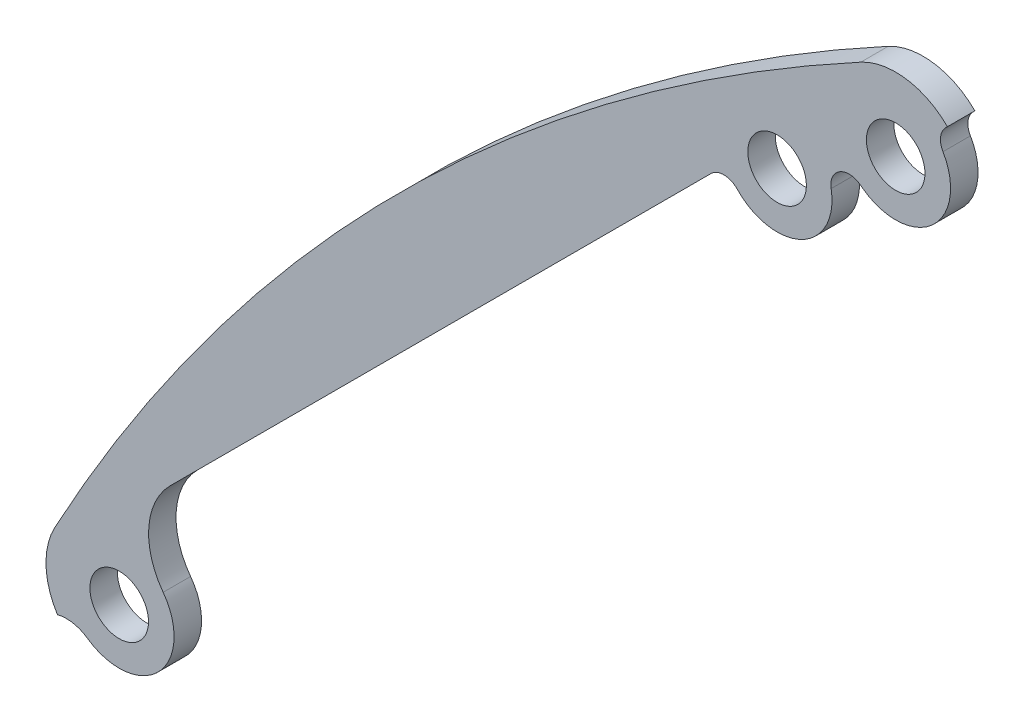
from build123d import *

# Parameters (mm, degrees)
FILLET1_OUTLINE_R    = 1.6
FILLET1_OUTLINE_R_2  = 1.4
FILLET1_DEPTH        = 1.5
FILLET2_R            = 1
FILLET3_R            = 4
FILLET6_R            = 1
FILLET7_R            = 1
FILLET8_R            = 2
BOSS_EXTRUDE1_DEPTH  = 1.5
FILLET9_R            = 4
BOSS_EXTRUDE2_START  = -1.5
SKETCH2_R            = 1.6
BOSS_EXTRUDE2_DEPTH  = 1.5
BOSS_EXTRUDE3_START  = -1.5
SKETCH3_R            = 1.6
BOSS_EXTRUDE3_DEPTH  = 1.5
CUT_EXTRUDE1_START   = -1.5
SKETCH4_R            = 1.6
CUT_EXTRUDE1_DEPTH   = 1.5
CUT_EXTRUDE3_DEPTH   = 10
FILLET10_R           = 2
SKETCH6_R            = 61
CUT_EXTRUDE4_DEPTH   = 10
CUT_EXTRUDE5_DEPTH   = 10
FILLET12_R           = 1
SKETCH8_R            = 1.6
BOSS_EXTRUDE5_DEPTH  = 5
CUT_EXTRUDE6_START   = -5
CUT_EXTRUDE6_DEPTH   = 5
SKETCH10_R           = 133.204065673
CUT_EXTRUDE7_DEPTH   = 1.5
FILLET13_R           = 1
FILLET14_R           = 2
CUT_EXTRUDE10_START  = -10
CUT_EXTRUDE10_DEPTH  = 10
BOSS_EXTRUDE10_DEPTH = 5
FILLET15_START       = 1
FILLET15_DEPTH       = 6
CUT_EXTRUDE13_START  = -10
CUT_EXTRUDE13_DEPTH  = 10
FILLET16_R           = 4
SKETCH14_R           = 1.6
CUT_EXTRUDE16_DEPTH  = 10
SKETCH15_R           = 3
SKETCH15_R_2         = 1.6
BOSS_EXTRUDE11_DEPTH = 5
FILLET17_R           = 1
SKETCH16_R           = 171.814222802
CUT_EXTRUDE17_DEPTH  = 3.5


with BuildPart() as part:
    # Fillet1: read off the stored shape, not the designer's step
    # Fillet1 outline → Fillet1 (new body)
    with BuildSketch(Plane.XY):
        with BuildLine():
            Line((-52.766471043, 89.536023665), (-42.779960262, 79.549512884))
            Line((-42.779960262, 79.549512884), (-79.549512883, 42.779960262))
            Line((-79.549512883, 42.779960262), (-89.536023665, 52.766471043))
            ThreePointArc((-89.536023665, 52.766471043), (-92.941929118, 53.896139266), (-95.883096534, 51.840445591))
            ThreePointArc((-95.883096534, 51.840445591), (-109, 0), (-95.883096534, -51.840445591))
            ThreePointArc((-95.883096534, -51.840445591), (-92.941929118, -53.896139266), (-89.536023665, -52.766471043))
            Line((-89.536023665, -52.766471043), (-79.549512883, -42.779960262))
            Line((-79.549512883, -42.779960262), (-42.779960262, -79.549512883))
            Line((-42.779960262, -79.549512883), (-52.766471043, -89.536023665))
            ThreePointArc((-52.766471043, -89.536023665), (-53.896139266, -92.941929118), (-51.840445591, -95.883096534))
            ThreePointArc((-51.840445591, -95.883096534), (-50.184016899, -96.760345431), (-48.512748328, -97.608981399))
            ThreePointArc((-48.512748328, -97.608981399), (-47.646815155, -97.921093641), (-46.732463985, -98.02700043))
            Line((-46.732463985, -98.02700043), (46.732463985, -98.02700043))
            ThreePointArc((46.732463985, -98.02700043), (47.646815155, -97.921093641), (48.512748328, -97.608981399))
            ThreePointArc((48.512748328, -97.608981399), (50.184016899, -96.760345431), (51.840445591, -95.883096534))
            ThreePointArc((51.840445591, -95.883096534), (53.896139266, -92.941929118), (52.766471043, -89.536023665))
            Line((52.766471043, -89.536023665), (42.779960262, -79.549512884))
            Line((42.779960262, -79.549512884), (79.549512884, -42.779960262))
            Line((79.549512884, -42.779960262), (89.536023665, -52.766471043))
            ThreePointArc((89.536023665, -52.766471043), (92.941929118, -53.896139266), (95.883096534, -51.840445591))
            ThreePointArc((95.883096534, -51.840445591), (109, 0), (95.883096534, 51.840445591))
            ThreePointArc((95.883096534, 51.840445591), (92.941929118, 53.896139266), (89.536023665, 52.766471043))
            Line((89.536023665, 52.766471043), (79.549512883, 42.779960262))
            Line((79.549512883, 42.779960262), (42.779960262, 79.549512884))
            Line((42.779960262, 79.549512884), (52.766471043, 89.536023665))
            ThreePointArc((52.766471043, 89.536023665), (53.896139266, 92.941929118), (51.840445591, 95.883096534))
            ThreePointArc((51.840445591, 95.883096534), (51.446125895, 96.095245098), (51.050938033, 96.305772029))
            Line((51.050938033, 96.305772029), (31.745166004, 77))
            Line((31.745166004, 77), (-31.745166004, 77))
            Line((-31.745166004, 77), (-51.050938033, 96.305772029))
            ThreePointArc((-51.050938033, 96.305772029), (-51.446125895, 96.095245098), (-51.840445591, 95.883096534))
            ThreePointArc((-51.840445591, 95.883096534), (-53.896139266, 92.941929118), (-52.766471043, 89.536023665))
        make_face()
        with Locations((-92.27579683, -50.101669827)):
            Circle(FILLET1_OUTLINE_R, mode=Mode.SUBTRACT)
        with Locations((-50.101669828, -92.275796829)):
            Circle(FILLET1_OUTLINE_R, mode=Mode.SUBTRACT)
        with BuildLine():
            Line((-27.999999998, -90.02700043), (-41.861882029, -90.02700043))
            Line((-41.861882029, -90.02700043), (-37.123106012, -85.206367133))
            ThreePointArc((-37.123106012, -85.206367133), (-34.779960262, -79.549512884), (-37.123106012, -73.892658634))
            Line((-37.123106012, -73.892658634), (-44.194173825, -66.821590821))
            Line((-44.194173825, -66.821590821), (-35.419577284, -58.046994281))
            ThreePointArc((-35.419577284, -58.046994281), (-31.770328056, -60.12192824), (-27.999999998, -61.96773354))
            Line((-27.999999998, -61.96773354), (-27.999999998, -90.02700043))
        make_face(mode=Mode.SUBTRACT)
        with Locations((-23.999999998, -90)):
            Circle(FILLET1_OUTLINE_R, mode=Mode.SUBTRACT)
        with Locations((-46.492270863, -64.877047174)):
            Circle(FILLET1_OUTLINE_R_2, mode=Mode.SUBTRACT)
        with BuildLine():
            Line((-40.489419991, -54.631555614), (-48.436814511, -62.578950135))
            Line((-48.436814511, -62.578950135), (-62.479030953, -48.536733693))
            Line((-62.479030953, -48.536733693), (-54.492060142, -40.676963769))
            ThreePointArc((-54.492060142, -40.676963769), (-48.000552605, -48.165827612), (-40.489419991, -54.631555614))
        make_face(mode=Mode.SUBTRACT)
        with Locations((-40.835416614, -59.220192924)):
            Circle(FILLET1_OUTLINE_R_2, mode=Mode.SUBTRACT)
        with Locations((-64.877047174, -46.492270863)):
            Circle(FILLET1_OUTLINE_R_2, mode=Mode.SUBTRACT)
        with Locations((-59.220192925, -40.835416614)):
            Circle(FILLET1_OUTLINE_R_2, mode=Mode.SUBTRACT)
        with BuildLine():
            ThreePointArc((-73.892658634, -37.123106012), (-79.549512884, -34.779960262), (-85.206367133, -37.123106012))
            ThreePointArc((-85.206367133, -37.123106012), (-88.293174595, -40.113953283), (-91.303559052, -43.1817103))
            ThreePointArc((-91.303559052, -43.1817103), (-94.614957198, -35.341333794), (-97.254498611, -27.25))
            Line((-97.254498611, -27.25), (-62.301183777, -27.25))
            ThreePointArc((-62.301183777, -27.25), (-60.218013119, -31.58782829), (-57.833278956, -35.767469092))
            Line((-57.833278956, -35.767469092), (-66.690457063, -44.325307583))
            Line((-66.690457063, -44.325307583), (-73.892658634, -37.123106012))
        make_face(mode=Mode.SUBTRACT)
        with Locations((-98, -23.25)):
            Circle(FILLET1_OUTLINE_R, mode=Mode.SUBTRACT)
        with Locations((-68.5, -23.25)):
            Circle(FILLET1_OUTLINE_R, mode=Mode.SUBTRACT)
        with Locations((23.999999998, -90)):
            Circle(FILLET1_OUTLINE_R, mode=Mode.SUBTRACT)
        with Locations((50.101669827, -92.275796829)):
            Circle(FILLET1_OUTLINE_R, mode=Mode.SUBTRACT)
        with BuildLine():
            ThreePointArc((28, -61.967733539), (31.770328056, -60.121928239), (35.419577283, -58.046994281))
            Line((35.419577283, -58.046994281), (44.194173824, -66.821590822))
            Line((44.194173824, -66.821590822), (37.123106012, -73.892658634))
            ThreePointArc((37.123106012, -73.892658634), (34.779960262, -79.549512884), (37.123106012, -85.206367133))
            ThreePointArc((37.123106012, -85.206367133), (39.468585064, -87.64018675), (41.861882029, -90.02700043))
            Line((41.861882029, -90.02700043), (28, -90.02700043))
            Line((28, -90.02700043), (28, -61.967733539))
        make_face(mode=Mode.SUBTRACT)
        with Locations((46.492270863, -64.877047174)):
            Circle(FILLET1_OUTLINE_R_2, mode=Mode.SUBTRACT)
        with Locations((40.835416614, -59.220192924)):
            Circle(FILLET1_OUTLINE_R_2, mode=Mode.SUBTRACT)
        with BuildLine():
            Line((62.479030953, -48.536733693), (48.436814511, -62.578950135))
            Line((48.436814511, -62.578950135), (40.489419991, -54.631555614))
            ThreePointArc((40.489419991, -54.631555614), (48.000552605, -48.165827612), (54.492060142, -40.676963769))
            Line((54.492060142, -40.676963769), (62.479030953, -48.536733693))
        make_face(mode=Mode.SUBTRACT)
        with Locations((92.27579683, -50.101669827)):
            Circle(FILLET1_OUTLINE_R, mode=Mode.SUBTRACT)
        with BuildLine():
            ThreePointArc((-20, -56.568542495), (0, 60), (20, -56.568542495))
            Line((20, -56.568542495), (20, -94.013500215))
            Line((20, -94.013500215), (-4e-09, -94.02700043))
            Line((-4e-09, -94.02700043), (-20, -94.013500215))
            Line((-20, -94.013500215), (-20, -56.568542495))
        make_face(mode=Mode.SUBTRACT)
        with Locations((64.877047174, -46.492270863)):
            Circle(FILLET1_OUTLINE_R_2, mode=Mode.SUBTRACT)
        with Locations((59.220192924, -40.835416614)):
            Circle(FILLET1_OUTLINE_R_2, mode=Mode.SUBTRACT)
        with BuildLine():
            Line((62.301183777, -27.25), (97.254498611, -27.25))
            ThreePointArc((97.254498611, -27.25), (94.614957198, -35.341333794), (91.303559052, -43.1817103))
            ThreePointArc((91.303559052, -43.1817103), (88.293174595, -40.113953283), (85.206367133, -37.123106012))
            ThreePointArc((85.206367133, -37.123106012), (79.549512884, -34.779960262), (73.892658634, -37.123106012))
            Line((73.892658634, -37.123106012), (66.690457063, -44.325307584))
            Line((66.690457063, -44.325307584), (57.833278956, -35.767469092))
            ThreePointArc((57.833278956, -35.767469092), (60.218013119, -31.58782829), (62.301183777, -27.25))
        make_face(mode=Mode.SUBTRACT)
        with Locations((68.5, -23.25)):
            Circle(FILLET1_OUTLINE_R, mode=Mode.SUBTRACT)
        with Locations((98, -23.25)):
            Circle(FILLET1_OUTLINE_R, mode=Mode.SUBTRACT)
        with BuildLine():
            ThreePointArc((-99.148562773, -19.25), (-101, 0), (-99.148562773, 19.25))
            Line((-99.148562773, 19.25), (-65.218383145, 19.25))
            ThreePointArc((-65.218383145, 19.25), (-68, 0), (-65.218383145, -19.25))
            Line((-65.218383145, -19.25), (-99.148562773, -19.25))
        make_face(mode=Mode.SUBTRACT)
        with Locations((-98, 23.25)):
            Circle(FILLET1_OUTLINE_R, mode=Mode.SUBTRACT)
        with Locations((-64, 0)):
            Circle(FILLET1_OUTLINE_R, mode=Mode.SUBTRACT)
        with Locations((-68.5, 23.25)):
            Circle(FILLET1_OUTLINE_R, mode=Mode.SUBTRACT)
        with BuildLine():
            Line((-62.301183777, 27.25), (-97.254498611, 27.25))
            ThreePointArc((-97.254498611, 27.25), (-94.614957198, 35.341333794), (-91.303559052, 43.1817103))
            ThreePointArc((-91.303559052, 43.1817103), (-88.293174595, 40.113953283), (-85.206367133, 37.123106012))
            ThreePointArc((-85.206367133, 37.123106012), (-79.549512884, 34.779960262), (-73.892658634, 37.123106012))
            Line((-73.892658634, 37.123106012), (-66.690457063, 44.325307584))
            Line((-66.690457063, 44.325307584), (-57.833278956, 35.767469092))
            ThreePointArc((-57.833278956, 35.767469092), (-60.218013119, 31.58782829), (-62.301183777, 27.25))
        make_face(mode=Mode.SUBTRACT)
        with Locations((-59.220192925, 40.835416614)):
            Circle(FILLET1_OUTLINE_R_2, mode=Mode.SUBTRACT)
        with Locations((-64.877047174, 46.492270863)):
            Circle(FILLET1_OUTLINE_R_2, mode=Mode.SUBTRACT)
        with Locations((-92.27579683, 50.101669827)):
            Circle(FILLET1_OUTLINE_R, mode=Mode.SUBTRACT)
        with BuildLine():
            ThreePointArc((-40.489419991, 54.631555614), (-48.000552605, 48.165827612), (-54.492060142, 40.676963769))
            Line((-54.492060142, 40.676963769), (-62.479030953, 48.536733693))
            Line((-62.479030953, 48.536733693), (-48.436814511, 62.578950135))
            Line((-48.436814511, 62.578950135), (-40.489419991, 54.631555614))
        make_face(mode=Mode.SUBTRACT)
        with Locations((-40.835416614, 59.220192924)):
            Circle(FILLET1_OUTLINE_R_2, mode=Mode.SUBTRACT)
        with Locations((-46.492270863, 64.877047174)):
            Circle(FILLET1_OUTLINE_R_2, mode=Mode.SUBTRACT)
        with BuildLine():
            Line((-44.194173824, 66.821590822), (-40.015764646, 71))
            Line((-40.015764646, 71), (-31.745166004, 71))
            Line((-31.745166004, 71), (-18.99999793, 70.951058904))
            Line((-18.99999793, 70.951058904), (-18.999992628, 68.264642036))
            Line((-18.999992628, 68.264642036), (-19.01142159, 65.288328583))
            ThreePointArc((-19.01142159, 65.288328583), (-27.455284376, 62.210990667), (-35.419577283, 58.046994281))
            Line((-35.419577283, 58.046994281), (-44.194173824, 66.821590822))
        make_face(mode=Mode.SUBTRACT)
        with Locations((-15, 66.122776602)):
            Circle(FILLET1_OUTLINE_R, mode=Mode.SUBTRACT)
        with Locations((-36.042175759, 77.089910724)):
            Circle(FILLET1_OUTLINE_R, mode=Mode.SUBTRACT)
        with Locations((-51.089613767, 91.732498958)):
            Circle(FILLET1_OUTLINE_R, mode=Mode.SUBTRACT)
        with Locations((64, 0)):
            Circle(FILLET1_OUTLINE_R, mode=Mode.SUBTRACT)
        with Locations((68.5, 23.25)):
            Circle(FILLET1_OUTLINE_R, mode=Mode.SUBTRACT)
        with BuildLine():
            ThreePointArc((99.148562773, 19.25), (101, 0), (99.148562773, -19.25))
            Line((99.148562773, -19.25), (65.218383145, -19.25))
            ThreePointArc((65.218383145, -19.25), (68, 0), (65.218383145, 19.25))
            Line((65.218383145, 19.25), (99.148562773, 19.25))
        make_face(mode=Mode.SUBTRACT)
        with Locations((98, 23.25)):
            Circle(FILLET1_OUTLINE_R, mode=Mode.SUBTRACT)
        with Locations((59.220192924, 40.835416614)):
            Circle(FILLET1_OUTLINE_R_2, mode=Mode.SUBTRACT)
        with Locations((64.877047174, 46.492270863)):
            Circle(FILLET1_OUTLINE_R_2, mode=Mode.SUBTRACT)
        with BuildLine():
            ThreePointArc((73.892658634, 37.123106012), (79.549512884, 34.779960262), (85.206367133, 37.123106012))
            ThreePointArc((85.206367133, 37.123106012), (88.293174595, 40.113953283), (91.303559052, 43.1817103))
            ThreePointArc((91.303559052, 43.1817103), (94.614957198, 35.341333794), (97.254498611, 27.25))
            Line((97.254498611, 27.25), (62.301183777, 27.25))
            ThreePointArc((62.301183777, 27.25), (60.218013119, 31.58782829), (57.833278956, 35.767469092))
            Line((57.833278956, 35.767469092), (66.690457063, 44.325307583))
            Line((66.690457063, 44.325307583), (73.892658634, 37.123106012))
        make_face(mode=Mode.SUBTRACT)
        with Locations((0, 64)):
            Circle(FILLET1_OUTLINE_R, mode=Mode.SUBTRACT)
        with BuildLine():
            Line((-11, 67.104396279), (-11, 70.930497512))
            Line((-11, 70.930497512), (0, 71))
            Line((0, 71), (11, 71))
            Line((11, 71), (11, 67.104396279))
            ThreePointArc((11, 67.104396279), (0, 68), (-11, 67.104396279))
        make_face(mode=Mode.SUBTRACT)
        with Locations((15, 66.122776602)):
            Circle(FILLET1_OUTLINE_R, mode=Mode.SUBTRACT)
        with Locations((40.835416614, 59.220192924)):
            Circle(FILLET1_OUTLINE_R_2, mode=Mode.SUBTRACT)
        with BuildLine():
            ThreePointArc((54.492060142, 40.676963769), (48.000552606, 48.165827612), (40.489419991, 54.631555614))
            Line((40.489419991, 54.631555614), (48.436814511, 62.578950135))
            Line((48.436814511, 62.578950135), (62.479030953, 48.536733693))
            Line((62.479030953, 48.536733693), (54.492060142, 40.676963769))
        make_face(mode=Mode.SUBTRACT)
        with BuildLine():
            Line((19.012475672, 65.288021634), (18.990729901, 70.951023316))
            Line((18.990729901, 70.951023316), (31.745166003, 71))
            Line((31.745166003, 71), (40.015764645, 71))
            Line((40.015764645, 71), (44.194173823, 66.821590822))
            Line((44.194173823, 66.821590822), (35.419577282, 58.046994281))
            ThreePointArc((35.419577282, 58.046994281), (27.455786576, 62.210769032), (19.012475672, 65.288021634))
        make_face(mode=Mode.SUBTRACT)
        with Locations((46.492270863, 64.877047174)):
            Circle(FILLET1_OUTLINE_R_2, mode=Mode.SUBTRACT)
        with Locations((36.042175759, 77.089910724)):
            Circle(FILLET1_OUTLINE_R, mode=Mode.SUBTRACT)
        with Locations((51.089613767, 91.732498958)):
            Circle(FILLET1_OUTLINE_R, mode=Mode.SUBTRACT)
        with Locations((92.27579683, 50.101669827)):
            Circle(FILLET1_OUTLINE_R, mode=Mode.SUBTRACT)
    extrude(amount=FILLET1_DEPTH)

    # Fillet2
    fillet2_edges = [part.edges().sort_by_distance(p)[0] for p in [
        (-51.050938033, 96.305772029, 0.75),
        (51.050938033, 96.305772029, 0.75),
    ]]
    fillet(fillet2_edges, radius=FILLET2_R)

    # Fillet3
    fillet3_edges = [part.edges().sort_by_distance(p)[0] for p in [
        (-31.745166004, 77, 0.75),
        (31.745166004, 77, 0.75),
    ]]
    fillet(fillet3_edges, radius=FILLET3_R)

    # Fillet6
    fillet6_edges = [part.edges().sort_by_distance(p)[0] for p in [
        (-48.436814511, 62.578950135, 0.75),
        (-40.489419991, 54.631555614, 0.75),
        (-62.479030953, 48.536733693, 0.75),
        (-54.492060142, 40.676963769, 0.75),
        (-44.194173824, 66.821590822, 0.75),
        (-40.015764646, 71, 0.75),
        (-35.419577283, 58.046994281, 0.75),
        (-19.01142159, 65.288328583, 0.75),
        (-18.99999793, 70.951058904, 0.75),
        (-31.745166004, 71, 0.75),
        (-57.833278956, 35.767469092, 0.75),
        (-66.690457063, 44.325307584, 0.75),
        (19.012475672, 65.288021634, 0.75),
        (18.990729901, 70.951023316, 0.75),
        (35.419577282, 58.046994281, 0.75),
        (44.194173823, 66.821590822, 0.75),
        (40.015764645, 71, 0.75),
        (31.745166003, 71, 0.75),
        (54.492060142, 40.676963769, 0.75),
        (40.489419991, 54.631555614, 0.75),
        (62.479030953, 48.536733693, 0.75),
        (48.436814511, 62.578950135, 0.75),
        (-11, 67.104396279, 0.75),
        (-11, 70.930497512, 0.75),
        (11, 67.104396279, 0.75),
        (11, 71, 0.75),
    ]]
    fillet(fillet6_edges, radius=FILLET6_R)

    # Fillet7
    fillet7_edges = [part.edges().sort_by_distance(p)[0] for p in [
        (40.489419991, -54.631555614, 0.75),
        (54.492060142, -40.676963769, 0.75),
        (48.436814511, -62.578950135, 0.75),
        (62.479030953, -48.536733693, 0.75),
        (-54.492060142, -40.676963769, 0.75),
        (-40.489419991, -54.631555614, 0.75),
        (-62.479030953, -48.536733693, 0.75),
        (-48.436814511, -62.578950135, 0.75),
        (66.690457063, 44.325307583, 0.75),
        (57.833278956, 35.767469092, 0.75),
        (62.301183777, 27.25, 0.75),
        (97.254498611, 27.25, 0.75),
        (91.303559052, 43.1817103, 0.75),
        (-99.148562773, 19.25, 0.75),
        (-99.148562773, -19.25, 0.75),
        (-65.218383145, -19.25, 0.75),
        (-65.218383145, 19.25, 0.75),
        (-66.690457063, -44.325307583, 0.75),
        (-57.833278956, -35.767469092, 0.75),
        (-62.301183777, -27.25, 0.75),
        (-97.254498611, -27.25, 0.75),
        (-91.303559052, -43.1817103, 0.75),
        (-62.301183777, 27.25, 0.75),
        (-97.254498611, 27.25, 0.75),
        (-91.303559052, 43.1817103, 0.75),
        (62.301183777, -27.25, 0.75),
        (97.254498611, -27.25, 0.75),
        (57.833278956, -35.767469092, 0.75),
        (66.690457063, -44.325307584, 0.75),
        (91.303559052, -43.1817103, 0.75),
        (99.148562773, -19.25, 0.75),
        (99.148562773, 19.25, 0.75),
        (65.218383145, 19.25, 0.75),
        (65.218383145, -19.25, 0.75),
        (28, -61.967733539, 0.75),
        (35.419577283, -58.046994281, 0.75),
        (28, -90.02700043, 0.75),
        (41.861882029, -90.02700043, 0.75),
        (44.194173824, -66.821590822, 0.75),
        (-41.861882029, -90.02700043, 0.75),
        (-27.999999998, -90.02700043, 0.75),
        (-27.999999998, -61.96773354, 0.75),
        (-35.419577284, -58.046994281, 0.75),
        (-44.194173825, -66.821590821, 0.75),
    ]]
    fillet(fillet7_edges, radius=FILLET7_R)

    # Fillet8
    fillet8_edges = [part.edges().sort_by_distance(p)[0] for p in [
        (20, -56.568542495, 0.75),
        (-20, -56.568542495, 0.75),
        (-20, -94.013500215, 0.75),
        (20, -94.013500215, 0.75),
        (-42.779960262, 79.549512884, 0.75),
        (42.779960262, 79.549512884, 0.75),
        (79.549512883, 42.779960262, 0.75),
        (79.549512884, -42.779960262, 0.75),
        (42.779960262, -79.549512884, 0.75),
        (-42.779960262, -79.549512883, 0.75),
        (-79.549512883, -42.779960262, 0.75),
        (-79.549512883, 42.779960262, 0.75),
    ]]
    fillet(fillet8_edges, radius=FILLET8_R)

    # Sketch1 → Boss-Extrude1 (add)
    with BuildSketch(Plane.XY.offset(1.5)):
        Polygon((51.840445591, 95.883096534), (49.820140502, 97.903401623), (28.916738879, 77), (30.937043968, 74.979694911), align=None)
        Polygon((-30.937043968, 74.979694911), (-51.840445591, 95.883096534), (-49.820140502, 97.903401623), (-28.916738879, 77), align=None)
    extrude(amount=-BOSS_EXTRUDE1_DEPTH)

    # Fillet9
    # the kernel refuses this fillet: 4 mm, written as the material it takes off along each edge
    with BuildSketch(Plane(origin=(49.820140502, 97.903401623, 11.083148475), x_dir=(-0.7071067811865457, -0.7071067811865495, 0), z_dir=(0, 0, -1))) as fillet9_piece_1:
        with BuildLine():
            CenterArc((3.83325939, -4), FILLET9_R, 90, 73.398450397)
            Line((0, -2.857142857), (-0.076665188, -2.834285714))
            ThreePointArc((-0.076665188, -2.834285714), (-0.08, -1.428571428), (-0.08, 0))
            Line((-0.08, 0), (0, 0.08))
            Line((0, 0.08), (3.83325939, 0.08))
            Line((3.83325939, 0.08), (3.83325939, 0))
        make_face()
    extrude(amount=20.66629695, mode=Mode.SUBTRACT)
    with BuildSketch(Plane(origin=(-49.820140502, 97.903401623, 11.083148475), x_dir=(-0.7071067811734814, -0.7071067811996137, 0), z_dir=(0, 0, -1))) as fillet9_piece_2:
        with BuildLine():
            CenterArc((4, -3.83325939), FILLET9_R, 106.601549604, 73.398450397)
            Line((0, -3.83325939), (-0.08, -3.83325939))
            Line((-0.08, -3.83325939), (-0.08, 0))
            Line((-0.08, 0), (0, 0.08))
            ThreePointArc((0, 0.08), (1.428571428, 0.08), (2.834285714, 0.076665188))
            Line((2.834285714, 0.076665188), (2.857142857, 0))
        make_face()
    extrude(amount=20.66629695, mode=Mode.SUBTRACT)

    # Sketch2 → Boss-Extrude2 (add)
    with BuildSketch(Plane.XY.offset(1.5).offset(BOSS_EXTRUDE2_START)):
        with Locations((51.089613767, 91.732498958)):
            Circle(SKETCH2_R)
    extrude(amount=BOSS_EXTRUDE2_DEPTH)

    # Sketch3 → Boss-Extrude3 (add)
    with BuildSketch(Plane.XY.offset(1.5).offset(BOSS_EXTRUDE3_START)):
        with Locations((-92.27579683, 50.101669827)):
            Circle(SKETCH3_R)
        with Locations((-92.27579683, -50.101669827)):
            Circle(SKETCH3_R)
        with Locations((92.364450789, 49.938043918)):
            Circle(SKETCH3_R)
        with Locations((-50.101669828, -92.275796829)):
            Circle(SKETCH3_R)
        with Locations((50.101669827, -92.275796829)):
            Circle(SKETCH3_R)
        with Locations((92.27579683, -50.101669827)):
            Circle(SKETCH3_R)
        with Locations((-51.089613767, 91.732498958)):
            Circle(SKETCH3_R)
    extrude(amount=BOSS_EXTRUDE3_DEPTH)

    # Sketch4 → Cut-Extrude1 (cut)
    with BuildSketch(Plane.XY.offset(1.5).offset(CUT_EXTRUDE1_START)):
        with Locations((92.364450789, 49.938043918)):
            Circle(SKETCH4_R)
        with Locations((49.938043918, 92.364450789)):
            Circle(SKETCH4_R)
        with Locations((-92.364450789, 49.938043918)):
            Circle(SKETCH4_R)
        with Locations(Location((-49.938043918, 92.364450789, 0), (0, 0, 180))):
            Circle(SKETCH4_R)
        with Locations(Location((-92.364450789, -49.938043918, 0), (0, 0, 180))):
            Circle(SKETCH4_R)
        with Locations((-49.938043918, -92.364450789)):
            Circle(SKETCH4_R)
        with Locations(Location((49.938043918, -92.364450789, 0), (0, 0, 180))):
            Circle(SKETCH4_R)
        with Locations((92.364450789, -49.938043918)):
            Circle(SKETCH4_R)
    extrude(amount=CUT_EXTRUDE1_DEPTH, mode=Mode.SUBTRACT)

    # Sketch5 → Cut-Extrude3 (cut)
    with BuildSketch(Plane.XY.offset(1.5)):
        Polygon((41.365746702, 78.135299324), (78.135299324, 41.365746702), (85.249875055, 48.480322434), (48.480322433, 85.249875055), align=None)
        Polygon((-48.480322433, 85.249875055), (-85.249875055, 48.480322434), (-78.135299324, 41.365746702), (-41.365746702, 78.135299324), align=None)
        Polygon((-41.365746702, -78.135299324), (-78.135299324, -41.365746702), (-85.249875055, -48.480322433), (-48.480322433, -85.249875055), align=None)
        Polygon((48.480322433, -85.249875055), (85.249875055, -48.480322433), (78.135299324, -41.365746702), (41.365746702, -78.135299324), align=None)
    extrude(amount=-CUT_EXTRUDE3_DEPTH, mode=Mode.SUBTRACT)

    # Fillet10
    fillet10_edges = [part.edges().sort_by_distance(p)[0] for p in [
        (-41.365746702, 78.135299324, 0.75),
        (-78.135299324, 41.365746702, 0.75),
        (78.135299324, 41.365746702, 0.75),
        (41.365746702, 78.135299324, 0.75),
        (-78.135299324, -41.365746702, 0.75),
        (-41.365746702, -78.135299324, 0.75),
        (41.365746702, -78.135299324, 0.75),
        (78.135299324, -41.365746702, 0.75),
    ]]
    fillet(fillet10_edges, radius=FILLET10_R)

    # Sketch6 → Cut-Extrude4 (cut)
    with BuildSketch(Plane.XY.offset(1.5)):
        Circle(SKETCH6_R)
    extrude(amount=-CUT_EXTRUDE4_DEPTH, mode=Mode.SUBTRACT)

    # Sketch7 → Cut-Extrude5 (cut)
    with BuildSketch(Plane.XY.offset(1.5)):
        Polygon((-21, -74.990178383), (-21, -49.799253287), (21, -49.799253287), (21, -74.990178383), (21, -95.02700043), (0, -95.02700043), (-21, -95.02700043), align=None)
    extrude(amount=-CUT_EXTRUDE5_DEPTH, mode=Mode.SUBTRACT)

    # Fillet12
    fillet12_edges = [part.edges().sort_by_distance(p)[0] for p in [
        (21, -57.271284253, 0.75),
        (-21, -57.271284253, 0.75),
        (21, -95.02700043, 0.75),
        (-21, -95.02700043, 0.75),
    ]]
    fillet(fillet12_edges, radius=FILLET12_R)

    # Sketch8 → Boss-Extrude5 (add)
    with BuildSketch(Plane.XY.offset(1.5)):
        with BuildLine():
            ThreePointArc((-51.840445591, -95.883096534), (-46.514100829, -90.296453274), (-53.93777787, -92.41058445))
            ThreePointArc((-53.93777787, -92.41058445), (-75.660425587, -75.660425587), (-92.41058445, -53.93777787))
            ThreePointArc((-92.41058445, -53.93777787), (-88.845805045, -48.035642245), (-95.736430137, -47.786357306))
            ThreePointArc((-95.736430137, -47.786357306), (-107, 0), (-95.736430137, 47.786357306))
            ThreePointArc((-95.736430137, 47.786357306), (-88.845805045, 48.035642245), (-92.41058445, 53.93777787))
            ThreePointArc((-92.41058445, 53.93777787), (-75.660425587, 75.660425587), (-53.93777787, 92.41058445))
            ThreePointArc((-53.93777787, 92.41058445), (-46.514100829, 90.296453274), (-51.840445591, 95.883096534))
            ThreePointArc((-51.840445591, 95.883096534), (-109, 0), (-51.840445591, -95.883096534))
        make_face()
        with Locations((-49.938043918, -92.364450789)):
            Circle(SKETCH8_R, mode=Mode.SUBTRACT)
        with Locations((-92.364450789, -49.938043918)):
            Circle(SKETCH8_R, mode=Mode.SUBTRACT)
        with Locations((-92.364450789, 49.938043918)):
            Circle(SKETCH8_R, mode=Mode.SUBTRACT)
        with Locations((-49.938043918, 92.364450789)):
            Circle(SKETCH8_R, mode=Mode.SUBTRACT)
    extrude(amount=BOSS_EXTRUDE5_DEPTH)

    # Sketch9 → Cut-Extrude6 (cut)
    with BuildSketch(Plane.XY.offset(6.5).offset(CUT_EXTRUDE6_START)):
        with BuildLine():
            Line((-94.8934353, -48.324278959), (-95.736430137, -47.786357306))
            ThreePointArc((-95.736430137, -47.786357306), (-88.85683433, -48.01538254), (-92.364450789, -53.938043918))
            Line((-92.364450789, -53.938043918), (-92.364450789, -52.938043918))
            ThreePointArc((-92.364450789, -52.938043918), (-89.733738445, -48.496047884), (-94.8934353, -48.324278959))
        make_face()
        with BuildLine():
            Line((-52.938043918, -92.364450789), (-53.938043918, -92.364450789))
            ThreePointArc((-53.938043918, -92.364450789), (-48.407310189, -88.668932659), (-47.109616793, -95.192877914))
            Line((-47.109616793, -95.192877914), (-47.816723575, -94.485771133))
            ThreePointArc((-47.816723575, -94.485771133), (-48.789993621, -89.592812192), (-52.938043918, -92.364450789))
        make_face()
        with BuildLine():
            Line((-47.816723575, 94.485771133), (-47.109616793, 95.192877914))
            ThreePointArc((-47.109616793, 95.192877914), (-48.407310189, 88.668932659), (-53.938043918, 92.364450789))
            Line((-53.938043918, 92.364450789), (-52.938043918, 92.364450789))
            ThreePointArc((-52.938043918, 92.364450789), (-48.789993621, 89.592812192), (-47.816723575, 94.485771133))
        make_face()
        with BuildLine():
            Line((-92.364450789, 53.938043918), (-92.364450789, 52.938043918))
            ThreePointArc((-92.364450789, 52.938043918), (-89.733738445, 48.496047884), (-94.8934353, 48.324278959))
            Line((-94.8934353, 48.324278959), (-95.736430137, 47.786357306))
            ThreePointArc((-95.736430137, 47.786357306), (-88.85683433, 48.01538254), (-92.364450789, 53.938043918))
        make_face()
    extrude(amount=CUT_EXTRUDE6_DEPTH, mode=Mode.SUBTRACT)

    # Sketch10 → Cut-Extrude7 (cut)
    with BuildSketch(Plane(origin=(0, 0, 0), x_dir=(-1, 0, 0), z_dir=(0, 0, -1))):
        Circle(SKETCH10_R)
    extrude(amount=-CUT_EXTRUDE7_DEPTH, mode=Mode.SUBTRACT)

    # Fillet13
    fillet13_edges = [part.edges().sort_by_distance(p)[0] for p in [
        (-47.816723575, -94.485771133, 4),
        (-47.816723575, 94.485771133, 4),
    ]]
    fillet(fillet13_edges, radius=FILLET13_R)

    # Fillet14
    # the kernel refuses this fillet: 2 mm, written as the material it adds along each edge
    with BuildSketch(Plane(origin=(-52.938043918, 92.364450789, 1.5), x_dir=(0.19364916731417084, -0.9810708435166791, 0), z_dir=(0, 0, 1))) as fillet14_piece_1:
        with BuildLine():
            CenterArc((1.549193339, -1.962141687), FILLET14_R, 101.165822505, 49.458398129)
            Line((-0.193649167, -0.981070844), (-0.228506017, -0.961449427))
            ThreePointArc((-0.228506017, -0.961449427), (-0.136067417, -0.482789455), (-0.039242834, 0.007745967))
            Line((-0.039242834, 0.007745967), (0.007745967, 0.039242834))
            ThreePointArc((0.007745967, 0.039242834), (0.580947502, -0.016787469), (1.154149037, 0.039242834))
            Line((1.154149037, 0.039242834), (1.161895004, 0))
        make_face()
    extrude(amount=5)
    with BuildSketch(Plane(origin=(-92.364450789, 52.938043918, 1.5), x_dir=(0.9810708435182302, -0.19364916730631312, 0), z_dir=(0, 0, 1)), Plane(origin=(-94.8934353, -48.324278959, 1.5), x_dir=(0.6909844981380313, 0.7228695756033262, 0), z_dir=(0, 0, 1))) as fillet14_piece_2:
        with BuildLine():
            CenterArc((1.549193338, 1.962141687), FILLET14_R, 209.375779372, 49.458398123)
            Line((-0.193649167, 0.981070843), (-0.228506017, 0.961449427))
            ThreePointArc((-0.228506017, 0.961449427), (-0.136067417, 0.482789455), (-0.039242834, -0.007745967))
            Line((-0.039242834, -0.007745967), (0.007745967, -0.039242834))
            ThreePointArc((0.007745967, -0.039242834), (0.580947502, 0.016787469), (1.154149037, -0.039242834))
            Line((1.154149037, -0.039242834), (1.161895004, 0))
        make_face()
    extrude(amount=5)
    with BuildSketch(Plane(origin=(-94.8934353, 48.324278959, 1.5), x_dir=(-0.8429948368990979, -0.5379216531814491, 0), z_dir=(0, 0, 1))) as fillet14_piece_3:
        with BuildLine():
            CenterArc((1.625, 1.899835519), FILLET14_R, 202.331645004, 49.458398131)
            Line((-0.225, 1.139901312), (-0.262, 1.124702628))
            ThreePointArc((-0.262, 1.124702628), (-0.096030303, 0.573201535), (-0.04, 0))
            Line((-0.04, 0), (0, -0.04))
            ThreePointArc((0, -0.04), (0.5, -0.04), (0.9875, -0.03799671))
            Line((0.9875, -0.03799671), (1, 0))
        make_face()
    extrude(amount=5)
    with BuildSketch(Plane(origin=(-92.364450789, -52.938043918, 1.5), x_dir=(0, -1, 0), z_dir=(0, 0, 1))) as fillet14_piece_4:
        with BuildLine():
            CenterArc((1.625, 1.899835519), FILLET14_R, 202.331645009, 49.458398123)
            Line((-0.225, 1.139901311), (-0.262, 1.124702627))
            ThreePointArc((-0.262, 1.124702627), (-0.096030303, 0.573201535), (-0.04, 0))
            Line((-0.04, 0), (0, -0.04))
            ThreePointArc((0, -0.04), (0.5, -0.04), (0.9875, -0.03799671))
            Line((0.9875, -0.03799671), (1, 0))
        make_face()
    extrude(amount=5)
    with BuildSketch(Plane(origin=(-52.938043918, -92.364450789, 1.5), x_dir=(0.19364916731417084, 0.9810708435166791, 0), z_dir=(0, 0, 1))) as fillet14_piece_5:
        with BuildLine():
            CenterArc((1.549193339, 1.962141687), FILLET14_R, 209.375779366, 49.458398129)
            Line((-0.193649167, 0.981070844), (-0.228506017, 0.961449427))
            ThreePointArc((-0.228506017, 0.961449427), (-0.136067417, 0.482789455), (-0.039242834, -0.007745967))
            Line((-0.039242834, -0.007745967), (0.007745967, -0.039242834))
            ThreePointArc((0.007745967, -0.039242834), (0.580947502, 0.016787469), (1.154149037, -0.039242834))
            Line((1.154149037, -0.039242834), (1.161895004, 0))
        make_face()
    extrude(amount=5)

    # Sketch11 → Cut-Extrude10 (cut)
    with BuildSketch(Plane.XY.offset(6.5).offset(CUT_EXTRUDE10_START)):
        with BuildLine():
            Line((-88.364450789, 49.938043918), (9.82122629, 9.54949028))
            Line((9.82122629, 9.54949028), (-5.943869165, -97.504332158))
            Line((-5.943869165, -97.504332158), (-89.530841379, -105.956947326))
            Line((-89.530841379, -105.956947326), (-146.820788627, 13.944964128))
            Line((-146.820788627, 13.944964128), (-95.883096534, 51.840445591))
            ThreePointArc((-95.883096534, 51.840445591), (-93.345627894, 46.06024925), (-88.364450789, 49.938043918))
        make_face()
    extrude(amount=CUT_EXTRUDE10_DEPTH, mode=Mode.SUBTRACT)

    # Sketch12 → Boss-Extrude10 (add)
    with BuildSketch(Plane.XY.offset(6.5)):
        Polygon((-93.436498454, 53.93777787), (-92.410389265, 53.937973055), (-53.93777787, 92.41058445), (-56.617507196, 92.364450789), (-71.854770116, 80.829786623), (-85.355729389, 66.224878191), align=None)
    extrude(amount=-BOSS_EXTRUDE10_DEPTH)

    # Fillet15: read off the stored shape, not the designer's step
    # Fillet15 outline → Fillet15 (cut)
    with BuildSketch(Plane.XY.offset(FILLET15_START)):
        with BuildLine():
            ThreePointArc((-53.603687452, 92.219504205), (-53.771652019, 92.313436894), (-53.93777787, 92.41058445))
            ThreePointArc((-53.93777787, 92.41058445), (-53.937977406, 92.387518003), (-53.938043918, 92.364450789))
            ThreePointArc((-53.938043918, 92.364450789), (-53.767557444, 92.299608804), (-53.603687452, 92.219504205))
        make_face()
        with BuildLine():
            ThreePointArc((-92.41058445, 53.93777787), (-92.313436894, 53.77165202), (-92.219504205, 53.603687453))
            ThreePointArc((-92.219504205, 53.603687453), (-92.299608804, 53.767557444), (-92.364450789, 53.938043918))
            ThreePointArc((-92.364450789, 53.938043918), (-92.387518003, 53.937977406), (-92.41058445, 53.93777787))
        make_face()
    extrude(amount=FILLET15_DEPTH, mode=Mode.SUBTRACT)

    # Sketch13 → Cut-Extrude13 (cut)
    with BuildSketch(Plane.XY.offset(6.5).offset(CUT_EXTRUDE13_START)):
        with BuildLine():
            Line((-91.224549478, 52.713043918), (-52.713043918, 91.224549478))
            ThreePointArc((-52.713043918, 91.224549478), (-52.879536719, 92.954043956), (-52.059364262, 94.485771133))
            Line((-52.059364262, 94.485771133), (-94.485771133, 52.059364262))
            ThreePointArc((-94.485771133, 52.059364262), (-92.954043956, 52.879536719), (-91.224549478, 52.713043918))
        make_face()
    extrude(amount=CUT_EXTRUDE13_DEPTH, mode=Mode.SUBTRACT)

    # Fillet16
    fillet16_edges = [part.edges().sort_by_distance(p)[0] for p in [
        (-52.059364262, 94.485771133, 4),
    ]]
    fillet(fillet16_edges, radius=FILLET16_R)
    fillet16_2_edges = [part.edges().sort_by_distance(p)[0] for p in [
        (-94.485771133, 52.059364262, 4),
    ]]
    fillet(fillet16_2_edges, radius=FILLET16_R)

    # Sketch14 → Cut-Extrude16 (cut)
    with BuildSketch(Plane.XY.offset(6.5)):
        with Locations((-56.416458876, 88.55610181)):
            Circle(SKETCH14_R)
    extrude(amount=-CUT_EXTRUDE16_DEPTH, mode=Mode.SUBTRACT)

    # Sketch15 → Boss-Extrude11 (add)
    with BuildSketch(Plane.XY.offset(6.5)):
        with Locations((-56.416458876, 88.55610181)):
            Circle(SKETCH15_R)
        with Locations((-56.416458876, 88.55610181)):
            Circle(SKETCH15_R_2, mode=Mode.SUBTRACT)
    extrude(amount=-BOSS_EXTRUDE11_DEPTH)

    # Fillet17
    fillet17_edges = [part.edges().sort_by_distance(p)[0] for p in [
        (-54.371433285, 90.751066578, 4),
        (-59.172962512, 87.372172883, 4),
    ]]
    fillet(fillet17_edges, radius=FILLET17_R)

    # Sketch16 → Cut-Extrude17 (cut)
    with BuildSketch(Plane.XY.offset(6.5)):
        Circle(SKETCH16_R)
    extrude(amount=-CUT_EXTRUDE17_DEPTH, mode=Mode.SUBTRACT)


solid = part.part
